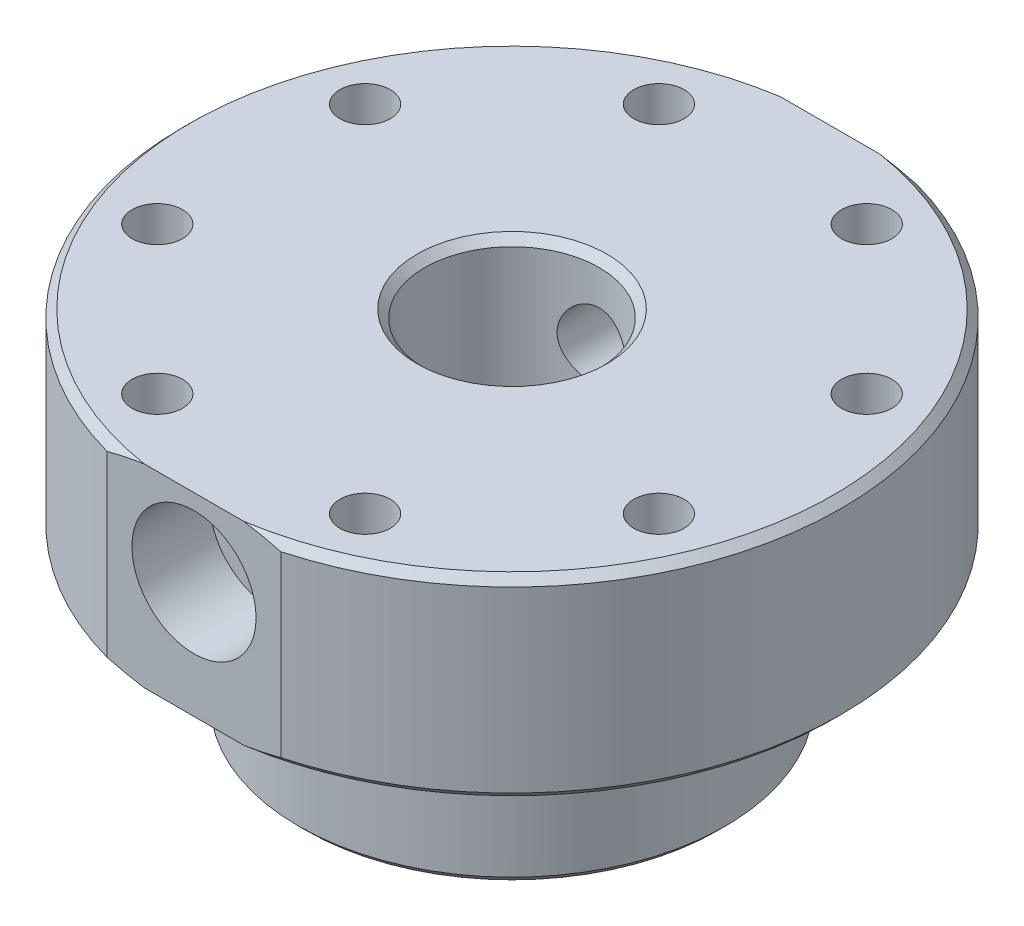
from build123d import *

# Parameters (mm, degrees)
SKETCH_1_R                    = 85
EXTRUDE_1_DEPTH               = 50
HOLE_WIZARD_M12_1_D           = 13
HOLE_WIZARD_M12_1_CBORE_D     = 22
HOLE_WIZARD_M12_1_CBORE_DEPTH = 15
PATTERN_CIRCULAR_1_COUNT      = 8
SKETCH_6_W                    = 44.766058572
SKETCH_6_H                    = 9.083836387
SKETCH_6_H_2                  = 8.147377862
CUT_EXTRUDE_1_DEPTH           = 131.192165663
SKETCH_7_R                    = 16
CUT_EXTRUDE_2_DEPTH           = 20
SKETCH_8_R                    = 9
CUT_EXTRUDE_3_DEPTH           = 175.530799574
CHAMFER_1_SIZE                = 2
SKETCH_9_R                    = 55
EXTRUDE_2_DEPTH               = 40
SKETCH_10_R                   = 22.5
CUT_EXTRUDE_4_DEPTH           = 149.489056836
SKETCH_11_W                   = 1.5
SKETCH_11_H                   = 3
CHAMFER_2_SIZE                = 5
CHAMFER_3_SIZE                = 2
CHAMFER_4_SIZE                = 2


with BuildPart() as part:
    # 草圖1 → 填料-伸長1 (new body)
    with BuildSketch(Plane(origin=(0, 0, 0), x_dir=(1, 0, 0), z_dir=(0, 1, 0))):
        with Locations(Location((0, 0, 0), (0, 0, 270))):
            Circle(SKETCH_1_R)
    extrude(amount=EXTRUDE_1_DEPTH)

    # M12 六角頭螺栓的柱孔1 (through all)
    with Locations(Plane.XZ):
        with Locations((-64.671567276, 26.787840266)):
            hole_wizard_m12_1 = CounterBoreHole(HOLE_WIZARD_M12_1_D / 2, HOLE_WIZARD_M12_1_CBORE_D / 2, HOLE_WIZARD_M12_1_CBORE_DEPTH)

    # 環狀複製排列1: M12 六角頭螺栓的柱孔1 ×8 about axis
    pattern_circular_1_axis = Axis((0, 0, 0), (0, 1, 0))
    for i in range(1, PATTERN_CIRCULAR_1_COUNT):
        add(hole_wizard_m12_1.rotate(pattern_circular_1_axis, i * 360 / PATTERN_CIRCULAR_1_COUNT), mode=Mode.SUBTRACT)

    # 草圖6 → 除料-伸長1 (cut, through all)
    with BuildSketch(Plane(origin=(0, 50, 0), x_dir=(1, 0, 0), z_dir=(0, 1, 0))):
        with Locations((0, 86.541918194)):
            Rectangle(SKETCH_6_W, SKETCH_6_H)
        with Locations((0, -86.073688931)):
            Rectangle(SKETCH_6_W, SKETCH_6_H_2)
    extrude(amount=-CUT_EXTRUDE_1_DEPTH, mode=Mode.SUBTRACT)

    # 草圖7 → 除料-伸長2 (cut)
    with BuildSketch(Plane(origin=(0, 0, -82), x_dir=(-1, 0, 0), z_dir=(0, 0, -1))):
        with Locations((0, 30)):
            Circle(SKETCH_7_R)
    cut_extrude_2 = extrude(amount=-CUT_EXTRUDE_2_DEPTH, mode=Mode.SUBTRACT)

    # 鏡射1: 除料-伸長2 across plane
    add(cut_extrude_2.mirror(Plane.XY), mode=Mode.SUBTRACT)

    # 草圖8 → 除料-伸長3 (cut, through all)
    with BuildSketch(Plane.XY.offset(62)):
        with Locations((0, 30)):
            Circle(SKETCH_8_R)
    extrude(amount=-CUT_EXTRUDE_3_DEPTH, mode=Mode.SUBTRACT)

    # 導角1
    chamfer_1_edges = [part.edges().sort_by_distance(p)[0] for p in [
        (-85, 50, 0),
        (-85, 0, 0),
        (85, 50, 0),
        (85, 0, 0),
    ]]
    chamfer(chamfer_1_edges, length=CHAMFER_1_SIZE)

    # 草圖9 → 填料-伸長2 (add)
    with BuildSketch(Plane.XZ):
        with Locations(Location((0, 0, 0), (0, 0, 90))):
            Circle(SKETCH_9_R)
    extrude(amount=EXTRUDE_2_DEPTH)

    # 草圖10 → 除料-伸長4 (cut, through all)
    with BuildSketch(Plane.XZ.offset(40)):
        with Locations(Location((0, 0, 0), (0, 0, 270))):
            Circle(SKETCH_10_R)
    extrude(amount=-CUT_EXTRUDE_4_DEPTH, mode=Mode.SUBTRACT)

    # 草圖11 → 除料-旋轉1 (revolve, cut)
    with BuildSketch(Plane.XY, mode=Mode.PRIVATE) as cut_revolve_1_sk:
        with Locations((-23.25, -25.5)):
            Rectangle(SKETCH_11_W, SKETCH_11_H)
        with Locations((-23.25, -17.5)):
            Rectangle(SKETCH_11_W, SKETCH_11_H)
        with Locations((-23.25, -33.5)):
            Rectangle(SKETCH_11_W, SKETCH_11_H)
        with Locations((-23.25, -9.5)):
            Rectangle(SKETCH_11_W, SKETCH_11_H)
        with Locations((-23.25, -1.5)):
            Rectangle(SKETCH_11_W, SKETCH_11_H)
    revolve(cut_revolve_1_sk.sketch.rotate(Axis((0, -1030.493185966, 0), (0, 1, 0)), 270), axis=Axis((0, -1030.493185966, 0), (0, 1, 0)), mode=Mode.SUBTRACT)

    # 導角2
    chamfer_2_edges = [part.edges().sort_by_distance(p)[0] for p in [
        (0, -40, 22.5),
    ]]
    chamfer(chamfer_2_edges, length=CHAMFER_2_SIZE - 0.0001)  # a hair under: the kernel refuses the full size

    # 導角3
    chamfer_3_edges = [part.edges().sort_by_distance(p)[0] for p in [
        (0, -40, -55),
    ]]
    chamfer(chamfer_3_edges, length=CHAMFER_3_SIZE)

    # 導角4
    chamfer_4_edges = [part.edges().sort_by_distance(p)[0] for p in [
        (0, 50, 22.5),
    ]]
    chamfer(chamfer_4_edges, length=CHAMFER_4_SIZE)


solid = part.part
